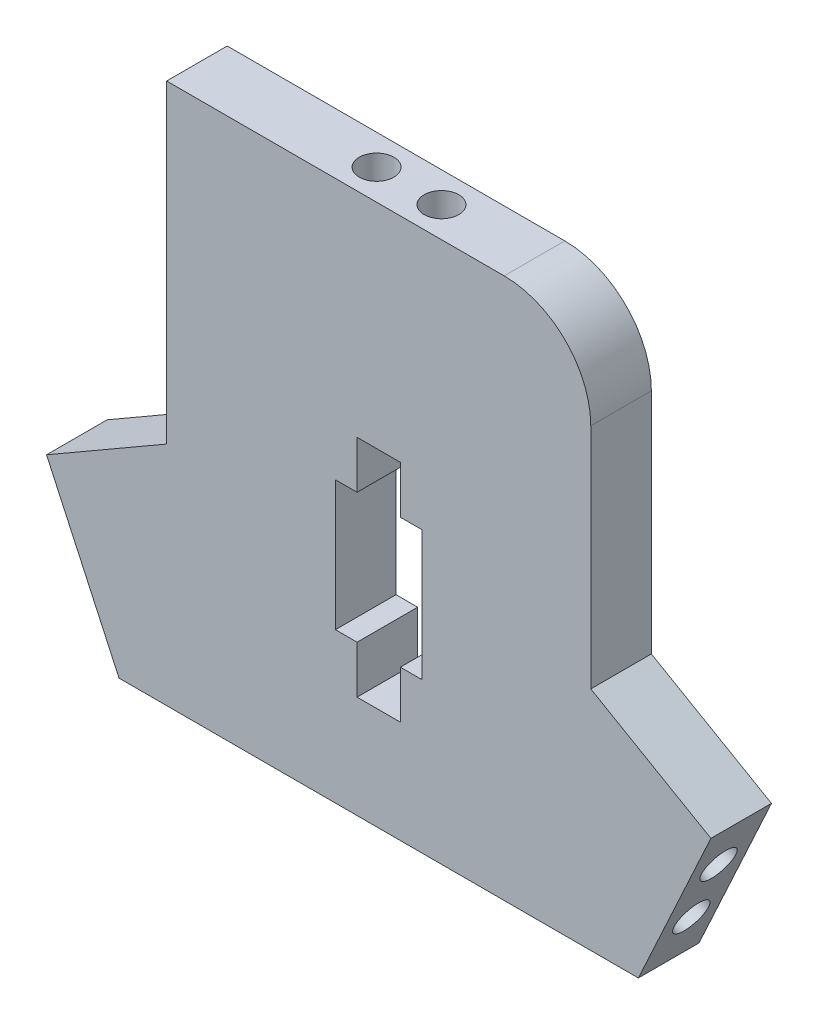
from build123d import *

# Parameters (mm, degrees)
BOSS_EXTRUDE1_DEPTH     = 7
CUT_EXTRUDE1_START      = -25
SKETCH2_R               = 2
CUT_EXTRUDE1_DEPTH      = 26
CUT_EXTRUDE3_DEPTH      = 7
CUT_EXTRUDE2_DEPTH      = 4
CIRPATTERN2_START       = 44.499207337
CIRPATTERN2_DEPTH       = 14
CIRPATTERN2_START_2     = 37.499207337
CIRPATTERN2_2_OUTLINE_R = 2
CIRPATTERN2_2_DEPTH     = 25.000152039
CIRPATTERN2_START_3     = -50.485397831
CIRPATTERN2_3_DEPTH     = 14
CIRPATTERN2_START_4     = -54.485701834
CIRPATTERN2_4_OUTLINE_R = 2
CIRPATTERN2_4_DEPTH     = 25.000304003
FILLET1_R               = 10


# Read off the part's stored shape, not the designer's step: CirPattern2
with BuildPart() as part:
    # Sketch1 → Boss-Extrude1 (new body)
    with BuildSketch(Plane.XY):
        Polygon((-54.5, 62.5), (-5.5, 62.5), (-5.5, 26.172980381), (8.376844495, 18.161180477), (0, 0), (-60, 0), (-68.376844495, 18.161180477), (-54.5, 26.172980381), align=None)
    extrude(amount=BOSS_EXTRUDE1_DEPTH)

    # Sketch2 → Cut-Extrude1 (cut)
    with BuildSketch(Plane(origin=(0, 0, 0), x_dir=(0, 0, -1), z_dir=(0.9080590238365492, -0.41884222474460864, 0)).offset(CUT_EXTRUDE1_START)):
        with Locations(Location((-3.5, 13.75, 0), (0, 0, 270))):
            Circle(SKETCH2_R)
        with Locations(Location((-3.5, 6.25, 0), (0, 0, 270))):
            Circle(SKETCH2_R)
    extrude(amount=CUT_EXTRUDE1_DEPTH, mode=Mode.SUBTRACT)

    # Sketch7 → Cut-Extrude3 (cut)
    with BuildSketch(Plane(origin=(0, 0, 0), x_dir=(-1, 0, 0), z_dir=(0, 0, -1))):
        Polygon((32.5, 17.35), (35, 17.35), (35, 32.35), (32.5, 32.35), (32.5, 37.85), (27.5, 37.85), (27.5, 32.35), (25, 32.35), (25, 17.35), (27.5, 17.35), (27.5, 11.85), (32.5, 11.85), align=None)
    extrude(amount=-CUT_EXTRUDE3_DEPTH, mode=Mode.SUBTRACT)

    # Sketch5 → Cut-Extrude2 (cut)
    with BuildSketch(Plane(origin=(0, 0, 0), x_dir=(-1, 0, 0), z_dir=(0, 0, -1))):
        Polygon((-3.069239501, 16.20431328), (1.956867196, 5.307604994), (14.66969353, 11.171396141), (9.643586833, 22.068104427), align=None)
    extrude(amount=-CUT_EXTRUDE2_DEPTH, mode=Mode.SUBTRACT)

    # CirPattern2 outline → CirPattern2 (cut)
    with BuildSketch(Plane(origin=(0, 0, 0), x_dir=(0.9999999996509443, -2.6421799769471613e-05, 0), z_dir=(2.642179976947161e-05, 0.9999999996509443, 0)).offset(CIRPATTERN2_START)):
        with BuildLine():
            ThreePointArc((-35.687148244, -4), (-33.750656571, -5.5), (-31.814164898, -4))
            Line((-31.814164898, -4), (-28.187148244, -4))
            ThreePointArc((-28.187148244, -4), (-26.250656571, -5.5), (-24.314164898, -4))
            Line((-24.314164898, -4), (-24.000656571, -4))
            Line((-24.000656571, -4), (-24.000656571, 0))
            Line((-24.000656571, 0), (-36.000656571, 0))
            Line((-36.000656571, 0), (-36.000656571, -4))
            Line((-36.000656571, -4), (-35.687148244, -4))
        make_face()
    extrude(amount=CIRPATTERN2_DEPTH, mode=Mode.SUBTRACT)

    # CirPattern2 2 outline → CirPattern2 2 (cut)
    with BuildSketch(Plane(origin=(0, 0, 0), x_dir=(0.9999999996509443, -2.6421799769471613e-05, 0), z_dir=(2.642179976947161e-05, 0.9999999996509443, 0)).offset(CIRPATTERN2_START_2)):
        with Locations((-33.750656571, -3.5)):
            Circle(CIRPATTERN2_2_OUTLINE_R)
        with Locations((-26.250656571, -3.5)):
            Circle(CIRPATTERN2_2_OUTLINE_R)
    extrude(amount=CIRPATTERN2_2_DEPTH, mode=Mode.SUBTRACT)

    # CirPattern2 3 outline → CirPattern2 3 (cut)
    with BuildSketch(Plane(origin=(0, 0, 0), x_dir=(-0.418794239052402, 0.908081155699489, 0), z_dir=(0.908081155699489, 0.418794239052402, 0)).offset(CIRPATTERN2_START_3)):
        with BuildLine():
            ThreePointArc((33.316135564, 4), (31.379643891, 5.5), (29.443152218, 4))
            Line((29.443152218, 4), (29.129643891, 4))
            Line((29.129643891, 4), (29.129643891, 0))
            Line((29.129643891, 0), (41.129643891, 0))
            Line((41.129643891, 0), (41.129643891, 4))
            Line((41.129643891, 4), (40.816135564, 4))
            ThreePointArc((40.816135564, 4), (38.879643891, 5.5), (36.943152218, 4))
            Line((36.943152218, 4), (33.316135564, 4))
        make_face()
    extrude(amount=CIRPATTERN2_3_DEPTH, mode=Mode.SUBTRACT)

    # CirPattern2 4 outline → CirPattern2 4 (cut)
    with BuildSketch(Plane(origin=(0, 0, 0), x_dir=(-0.418794239052402, 0.908081155699489, 0), z_dir=(0.908081155699489, 0.418794239052402, 0)).offset(CIRPATTERN2_START_4)):
        with Locations((31.379643891, 3.5)):
            Circle(CIRPATTERN2_4_OUTLINE_R)
        with Locations((38.879643891, 3.5)):
            Circle(CIRPATTERN2_4_OUTLINE_R)
    extrude(amount=CIRPATTERN2_4_DEPTH, mode=Mode.SUBTRACT)

    # Fillet1
    fillet1_edges = [part.edges().sort_by_distance(p)[0] for p in [
        (-5.5, 62.5, 3.5),
    ]]
    fillet(fillet1_edges, radius=FILLET1_R)


solid = part.part
